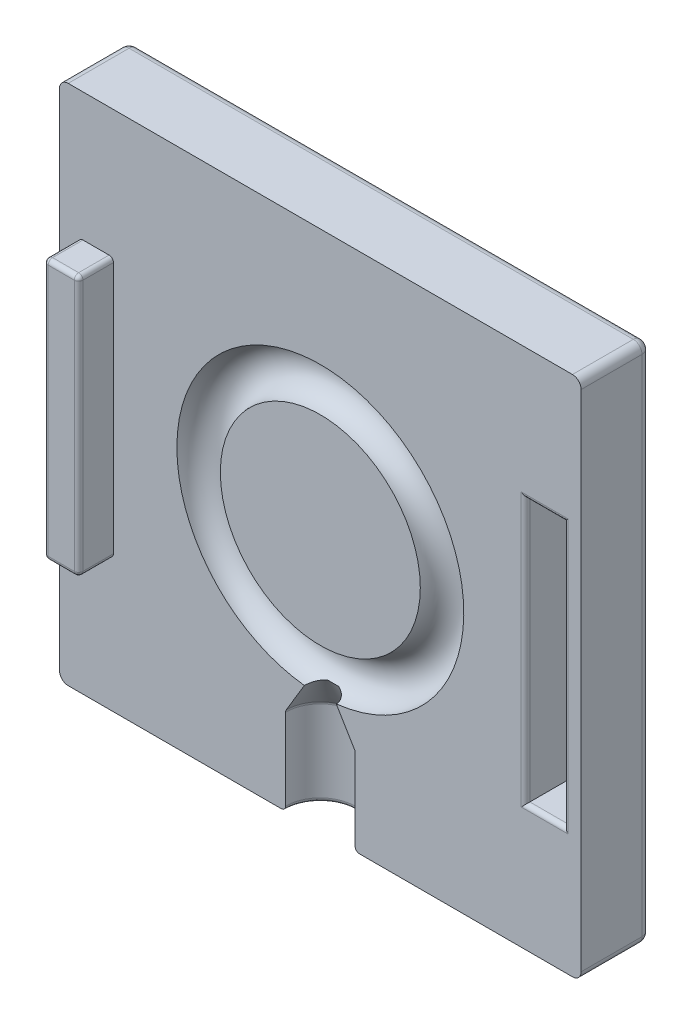
from build123d import *

# Parameters (mm, degrees)
SKETCH1_W           = 30
SKETCH1_H           = 30
BOSS_EXTRUDE1_DEPTH = 4
SKETCH4_R           = 1.25
SKETCH7_W           = 2
SKETCH7_H           = 15
BOSS_EXTRUDE2_DEPTH = 2
SKETCH8_W           = 2.2
SKETCH8_H           = 15.2
CUT_EXTRUDE2_DEPTH  = 2.5
FILLET1_R           = 0.25
FILLET2_R           = 0.25
FILLET3_R           = 0.25
FILLET5_R           = 0.5
FILLET6_R           = 0.5
FILLET7_R           = 0.25


with BuildPart() as part:
    # Sketch1 → Boss-Extrude1 (new body)
    with BuildSketch(Plane.XY):
        Rectangle(SKETCH1_W, SKETCH1_H)
    extrude(amount=BOSS_EXTRUDE1_DEPTH)

    # Sketch4 → Cut-Revolve1 (revolve, cut)
    with BuildSketch(Plane(origin=(0, 0, 0), x_dir=(1, 0, 0), z_dir=(0, 1, 0)), mode=Mode.PRIVATE) as cut_revolve1_sk:
        with Locations((7, -4)):
            Circle(SKETCH4_R)
    revolve(cut_revolve1_sk.sketch.rotate(Axis((0, 0, 0), (0, 0, 1)), 180), axis=Axis((0, 0, 0), (0, 0, 1)), mode=Mode.SUBTRACT)

    # Sketch9 → Cut-Revolve2 (revolve, cut)
    with BuildSketch(Plane(origin=(0, 0, 0), x_dir=(0, 0, -1), z_dir=(1, 0, 0))):
        Polygon((-4, -8), (-4.8, -8), (-6, -10), (-6, -15), (-4, -15), align=None)
    revolve(axis=Axis((0, -8, 4), (0, -1, 0)), mode=Mode.SUBTRACT)

    # Sketch7 → Boss-Extrude2 (add)
    with BuildSketch(Plane.XY.offset(4)):
        with Locations((-12.9, 0.121431972)):
            Rectangle(SKETCH7_W, SKETCH7_H)
    extrude(amount=BOSS_EXTRUDE2_DEPTH)

    # Sketch8 → Cut-Extrude2 (cut)
    with BuildSketch(Plane.XY.offset(4)):
        with Locations((12.9, -0.165781366)):
            Rectangle(SKETCH8_W, SKETCH8_H)
    extrude(amount=-CUT_EXTRUDE2_DEPTH, mode=Mode.SUBTRACT)

    # Fillet1
    fillet1_edges = [part.edges().sort_by_distance(p)[0] for p in [
        (-13.9, 0.121431972, 6),
        (-12.9, -7.378568028, 6),
        (-11.9, 0.121431972, 6),
        (-12.9, 7.621431972, 6),
    ]]
    fillet(fillet1_edges, radius=FILLET1_R)

    # Fillet2
    # the kernel refuses this fillet: 0.25 mm, written as the material it takes off along each edge
    with BuildSketch(Plane(origin=(-12.15, -7.128568028, 5.75), x_dir=(0, -1, 0), z_dir=(1, 0, 0))) as fillet2_piece_1_section:
        Polygon((0, 0), (FILLET2_R, 0), (FILLET2_R, -FILLET2_R), (0, -FILLET2_R), align=None)
    fillet2_piece_1 = extrude(amount=FILLET2_R, mode=Mode.PRIVATE)
    fillet2_piece_1 = fillet2_piece_1 - Plane(origin=(-12.15, -7.128568028, 5.75), x_dir=(0, 0.7071067811865475, -0.7071067811865475), z_dir=(1, 0, 0)) * Sphere(FILLET2_R, mode=Mode.PRIVATE)
    add(fillet2_piece_1, mode=Mode.SUBTRACT)
    with BuildSketch(Plane(origin=(-13.65, -7.128568028, 5.75), x_dir=(-1, 0, 0), z_dir=(0, -1, 0))) as fillet2_piece_2_section:
        Polygon((0, 0), (FILLET2_R, 0), (FILLET2_R, -FILLET2_R), (0, -FILLET2_R), align=None)
    fillet2_piece_2 = extrude(amount=FILLET2_R, mode=Mode.PRIVATE)
    fillet2_piece_2 = fillet2_piece_2 - Plane(origin=(-13.65, -7.128568028, 5.75), x_dir=(0.7071067811865475, 0, -0.7071067811865475), z_dir=(0, -1, 0)) * Sphere(FILLET2_R, mode=Mode.PRIVATE)
    add(fillet2_piece_2, mode=Mode.SUBTRACT)
    with BuildSketch(Plane(origin=(-12.15, 7.371431972, 5.75), x_dir=(0, 1, 0), z_dir=(1, 0, 0))) as fillet2_piece_3_section:
        Polygon((0, 0), (FILLET2_R, 0), (FILLET2_R, FILLET2_R), (0, FILLET2_R), align=None)
    fillet2_piece_3 = extrude(amount=FILLET2_R, mode=Mode.PRIVATE)
    fillet2_piece_3 = fillet2_piece_3 - Plane(origin=(-12.15, 7.371431972, 5.75), x_dir=(0, -0.7071067811865475, -0.7071067811865475), z_dir=(1, 0, 0)) * Sphere(FILLET2_R, mode=Mode.PRIVATE)
    add(fillet2_piece_3, mode=Mode.SUBTRACT)
    with BuildSketch(Plane(origin=(-13.65, 7.371431972, 5.75), x_dir=(-1, 0, 0), z_dir=(0, 1, 0))) as fillet2_piece_4_section:
        Polygon((0, 0), (FILLET2_R, 0), (FILLET2_R, FILLET2_R), (0, FILLET2_R), align=None)
    fillet2_piece_4 = extrude(amount=FILLET2_R, mode=Mode.PRIVATE)
    fillet2_piece_4 = fillet2_piece_4 - Plane(origin=(-13.65, 7.371431972, 5.75), x_dir=(0.7071067811865475, 0, -0.7071067811865475), z_dir=(0, 1, 0)) * Sphere(FILLET2_R, mode=Mode.PRIVATE)
    add(fillet2_piece_4, mode=Mode.SUBTRACT)
    with BuildSketch(Plane(origin=(-13.9, 7.621431972, 4), x_dir=(1, 0, 0), z_dir=(0, 0, 1)), Plane(origin=(-11.9, 7.621431972, 4), x_dir=(0, -1, 0), z_dir=(0, 0, 1))) as fillet2_piece_5:
        with BuildLine():
            CenterArc((FILLET2_R, -FILLET2_R), FILLET2_R, 90, 90)
            Line((0, -FILLET2_R), (0, 0))
            Line((0, 0), (FILLET2_R, 0))
        make_face()
    extrude(amount=1.75, mode=Mode.SUBTRACT)
    with BuildSketch(Plane(origin=(-11.9, -7.378568028, 4), x_dir=(0, 1, 0), z_dir=(0, 0, 1)), Plane(origin=(-13.9, -7.378568028, 4), x_dir=(1, 0, 0), z_dir=(0, 0, 1))) as fillet2_piece_6:
        with BuildLine():
            CenterArc((FILLET2_R, FILLET2_R), FILLET2_R, 180, 90)
            Line((0, FILLET2_R), (0, 0))
            Line((0, 0), (FILLET2_R, 0))
        make_face()
    extrude(amount=1.75, mode=Mode.SUBTRACT)

    # Fillet3
    fillet3_edges = [part.edges().sort_by_distance(p)[0] for p in [
        (11.8, -0.165781366, 4),
        (12.9, -7.765781366, 4),
        (14, -0.165781366, 4),
        (12.9, 7.434218634, 4),
    ]]
    fillet(fillet3_edges, radius=FILLET3_R)

    # Fillet5
    fillet5_edges = [part.edges().sort_by_distance(p)[0] for p in [
        (0, 15, 0),
        (15, 0, 0),
        (0, -15, 0),
        (-15, 0, 0),
    ]]
    fillet(fillet5_edges, radius=FILLET5_R)

    # Fillet6
    # the kernel refuses this fillet: 0.5 mm, written as the material it takes off along each edge
    with BuildSketch(Plane(origin=(-14.5, 14.5, 0.5), x_dir=(-1, 0, 0), z_dir=(0, 1, 0))) as fillet6_piece_1_section:
        Polygon((0, 0), (FILLET6_R, 0), (FILLET6_R, -FILLET6_R), (0, -FILLET6_R), align=None)
    fillet6_piece_1 = extrude(amount=FILLET6_R, mode=Mode.PRIVATE)
    fillet6_piece_1 = fillet6_piece_1 - Plane(origin=(-14.5, 14.5, 0.5), x_dir=(0.7071067811865475, 0, 0.7071067811865475), z_dir=(0, 1, 0)) * Sphere(FILLET6_R, mode=Mode.PRIVATE)
    add(fillet6_piece_1, mode=Mode.SUBTRACT)
    with BuildSketch(Plane(origin=(14.5, 14.5, 0.5), x_dir=(0, 1, 0), z_dir=(1, 0, 0))) as fillet6_piece_2_section:
        Polygon((0, 0), (FILLET6_R, 0), (FILLET6_R, -FILLET6_R), (0, -FILLET6_R), align=None)
    fillet6_piece_2 = extrude(amount=FILLET6_R, mode=Mode.PRIVATE)
    fillet6_piece_2 = fillet6_piece_2 - Plane(origin=(14.5, 14.5, 0.5), x_dir=(0, -0.7071067811865475, 0.7071067811865475), z_dir=(1, 0, 0)) * Sphere(FILLET6_R, mode=Mode.PRIVATE)
    add(fillet6_piece_2, mode=Mode.SUBTRACT)
    with BuildSketch(Plane(origin=(-14.5, -14.5, 0.5), x_dir=(-1, 0, 0), z_dir=(0, -1, 0))) as fillet6_piece_3_section:
        Polygon((0, 0), (FILLET6_R, 0), (FILLET6_R, FILLET6_R), (0, FILLET6_R), align=None)
    fillet6_piece_3 = extrude(amount=FILLET6_R, mode=Mode.PRIVATE)
    fillet6_piece_3 = fillet6_piece_3 - Plane(origin=(-14.5, -14.5, 0.5), x_dir=(0.7071067811865475, 0, 0.7071067811865475), z_dir=(0, -1, 0)) * Sphere(FILLET6_R, mode=Mode.PRIVATE)
    add(fillet6_piece_3, mode=Mode.SUBTRACT)
    with BuildSketch(Plane(origin=(14.5, -14.5, 0.5), x_dir=(0, -1, 0), z_dir=(1, 0, 0))) as fillet6_piece_4_section:
        Polygon((0, 0), (FILLET6_R, 0), (FILLET6_R, FILLET6_R), (0, FILLET6_R), align=None)
    fillet6_piece_4 = extrude(amount=FILLET6_R, mode=Mode.PRIVATE)
    fillet6_piece_4 = fillet6_piece_4 - Plane(origin=(14.5, -14.5, 0.5), x_dir=(0, 0.7071067811865475, 0.7071067811865475), z_dir=(1, 0, 0)) * Sphere(FILLET6_R, mode=Mode.PRIVATE)
    add(fillet6_piece_4, mode=Mode.SUBTRACT)
    with BuildSketch(Plane(origin=(-15, 15, 0.5), x_dir=(1, 0, 0), z_dir=(0, 0, 1)), Plane(origin=(15, 15, 0.5), x_dir=(0, -1, 0), z_dir=(0, 0, 1))) as fillet6_piece_5:
        with BuildLine():
            CenterArc((FILLET6_R, -FILLET6_R), FILLET6_R, 90, 90)
            Line((0, -FILLET6_R), (0, 0))
            Line((0, 0), (FILLET6_R, 0))
        make_face()
    extrude(amount=4.75, mode=Mode.SUBTRACT)
    with BuildSketch(Plane(origin=(15, -15, 0.5), x_dir=(0, 1, 0), z_dir=(0, 0, 1)), Plane(origin=(-15, -15, 0.5), x_dir=(1, 0, 0), z_dir=(0, 0, 1))) as fillet6_piece_6:
        with BuildLine():
            CenterArc((FILLET6_R, FILLET6_R), FILLET6_R, 180, 90)
            Line((0, FILLET6_R), (0, 0))
            Line((0, 0), (FILLET6_R, 0))
        make_face()
    extrude(amount=4.75, mode=Mode.SUBTRACT)

    # Fillet7
    fillet7_edges = [part.edges().sort_by_distance(p)[0] for p in [
        (0, -10, 2),
        (0, -15, 2),
    ]]
    fillet(fillet7_edges, radius=FILLET7_R)


solid = part.part
